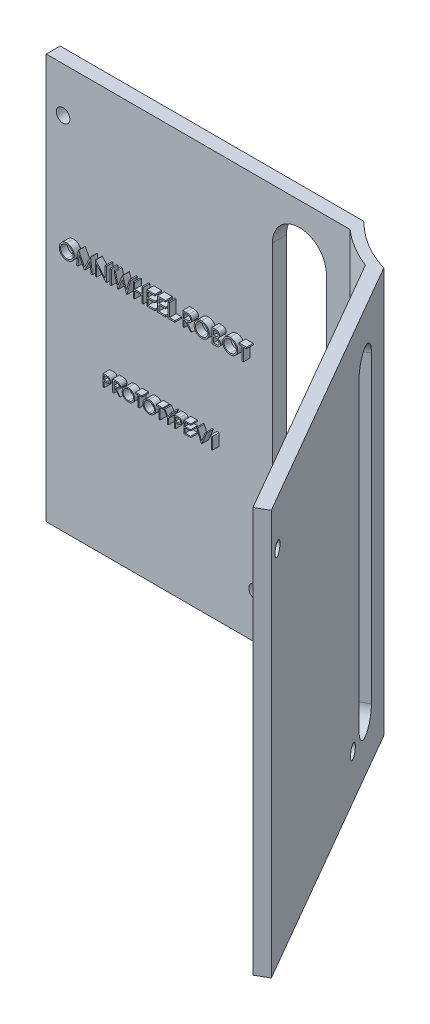
from build123d import *

# Parameters (mm, degrees)
BOSS_EXTRU_1_DEPTH      = 120
ENL_V_MAT_EXTRU_1_DEPTH = 188.009777727
ENL_V_MAT_EXTRU_2_DEPTH = 180.784310366
ESQUISSE6_R             = 2
ENL_V_MAT_EXTRU_3_DEPTH = 188.009777727
ESQUISSE7_R             = 2
ENL_V_MAT_EXTRU_4_DEPTH = 180.784310366
ESQUISSE8_W             = 0.379914529
ESQUISSE8_H             = 4.233333333
BOSS_EXTRU_2_DEPTH      = 2
ESQUISSE9_R             = 2
ENL_V_MAT_EXTRU_5_DEPTH = 188.009777853
ESQUISSE10_R            = 2
ENL_V_MAT_EXTRU_6_DEPTH = 180.784310483


with BuildPart() as part:
    # Esquisse3 → Boss.-Extru.1 (new body)
    with BuildSketch(Plane(origin=(0, 0, 0), x_dir=(1, 0, 0), z_dir=(0, 1, 0))):
        with BuildLine():
            ThreePointArc((-10.103808925, -33.509894736), (-18.121448463, -29.943498553), (-25, -24.494897428))
            Line((-25, -24.494897428), (-115, -24.494897428))
            Line((-115, -24.494897428), (-115, -28.618176043))
            Line((-115, -28.618176043), (-25, -28.618176043))
            ThreePointArc((-25, -28.618176043), (-19.581111, -32.566548666), (-13.552631037, -35.50107311))
            Line((-13.552631037, -35.50107311), (31.963111135, -114.336651096))
            Line((31.963111135, -114.336651096), (35.411933246, -112.345472721))
            Line((35.411933246, -112.345472721), (-10.103808925, -33.509894736))
        make_face()
    extrude(amount=BOSS_EXTRU_1_DEPTH)

    # Esquisse4 → Enlèv. mat.-Extru.1 (cut, through all)
    with BuildSketch(Plane.XY.offset(28.618176043)):
        with BuildLine():
            Line((-48, 105), (-48, 15))
            ThreePointArc((-48, 15), (-40, 7), (-32, 15))
            Line((-32, 15), (-32, 105))
            ThreePointArc((-32, 105), (-40, 113), (-48, 105))
        make_face()
    extrude(amount=-ENL_V_MAT_EXTRU_1_DEPTH, mode=Mode.SUBTRACT)

    # Esquisse5 → Enlèv. mat.-Extru.2 (cut, through all)
    with BuildSketch(Plane(origin=(-25.536888865, 0, 14.743729661), x_dir=(0.4999999999999999, 0, 0.8660254037844386), z_dir=(-0.8660254037844387, 0, 0.49999999999999994))):
        with BuildLine():
            Line((43.968515657, 105), (43.968515657, 15))
            ThreePointArc((43.968515657, 15), (38.968515657, 10), (33.968515657, 15))
            Line((33.968515657, 15), (33.968515657, 105))
            ThreePointArc((33.968515657, 105), (38.968515657, 110), (43.968515657, 105))
        make_face()
    extrude(amount=-ENL_V_MAT_EXTRU_2_DEPTH, mode=Mode.SUBTRACT)

    # Esquisse6 → Enlèv. mat.-Extru.3 (cut, through all)
    with BuildSketch(Plane.XY.offset(28.618176043)):
        with Locations((-110, 106.75)):
            Circle(ESQUISSE6_R)
    extrude(amount=-ENL_V_MAT_EXTRU_3_DEPTH, mode=Mode.SUBTRACT)

    # Esquisse7 → Enlèv. mat.-Extru.4 (cut, through all)
    with BuildSketch(Plane(origin=(-25.536888865, 0, 14.743729661), x_dir=(0.4999999999999999, 0, 0.8660254037844386), z_dir=(-0.8660254037844387, 0, 0.49999999999999994))):
        with Locations((110, 106.75)):
            Circle(ESQUISSE7_R)
    extrude(amount=-ENL_V_MAT_EXTRU_4_DEPTH, mode=Mode.SUBTRACT)

    # Esquisse8 → Boss.-Extru.2 (add)
    # profile 1 of 25: a face of its own
    with BuildSketch(Plane.XY.offset(28.618176043)):
        with BuildLine():
            add(Edge.make_bspline(
                [(-106.927136752, 76.562203816), (-106.848749805, 76.560218407), (-106.694791374, 76.556318902), (-106.468519831, 76.526468938), (-106.252504811, 76.474827848), (-106.044986643, 76.406050716), (-105.848447519, 76.314303031), (-105.661408096, 76.203407661), (-105.484313401, 76.072202802), (-105.319550397, 75.921702689), (-105.168774848, 75.757953178), (-105.035937823, 75.583203706), (-104.924610477, 75.398510869), (-104.833187668, 75.204429674), (-104.761464588, 75.001399046), (-104.71197203, 74.788336585), (-104.680357315, 74.566622779), (-104.67666128, 74.41539981), (-104.674786325, 74.338686188)],
                knots=[0, 0, 0, 0, 1.065120563, 2.091984664, 3.0946048, 4.079830382, 5.057816894, 6.036188127, 7.030412546, 8.04752943, 9.064399622, 10.05169764, 11.02544977, 11.989514704, 12.962713494, 13.945757189, 14.957906945, 16, 16, 16, 16], degree=3))
            add(Edge.make_bspline(
                [(-104.674786325, 74.338686188), (-104.676661005, 74.262537657), (-104.680356217, 74.112440082), (-104.712007977, 73.89213325), (-104.761648043, 73.680356883), (-104.832521622, 73.477464522), (-104.92350863, 73.283242136), (-105.035577265, 73.098200773), (-105.167586158, 72.92227977), (-105.317817302, 72.757406356), (-105.481588086, 72.606218939), (-105.657247552, 72.474478965), (-105.840845186, 72.361117405), (-106.034743595, 72.270664771), (-106.236371259, 72.19836921), (-106.447532735, 72.149077934), (-106.667238567, 72.117283129), (-106.817063496, 72.113632162), (-106.893215812, 72.111776465)],
                knots=[0, 0, 0, 0, 1.043624062, 2.057103931, 3.04512605, 4.022047818, 4.998200453, 5.980619268, 6.982898556, 8.009068085, 9.034988726, 10.034168286, 11.015286542, 11.987931943, 12.962482838, 13.94673481, 14.956375938, 16, 16, 16, 16], degree=3))
            add(Edge.make_bspline(
                [(-106.893215812, 72.111776465), (-106.969929036, 72.113650486), (-107.121151221, 72.117344679), (-107.343143635, 72.149011711), (-107.556355763, 72.198531193), (-107.760177883, 72.269299749), (-107.954723655, 72.36076059), (-108.140373565, 72.472283982), (-108.316382438, 72.604614524), (-108.481291027, 72.754796952), (-108.632178152, 72.918290163), (-108.763725207, 73.093470643), (-108.875273677, 73.276901528), (-108.966427422, 73.469091867), (-109.038593006, 73.669112564), (-109.087826453, 73.878297866), (-109.119680414, 74.095455173), (-109.123351133, 74.243310869), (-109.125213675, 74.318333624)],
                knots=[0, 0, 0, 0, 1.053102029, 2.075944431, 3.073151272, 4.055350789, 5.033113405, 6.020478099, 7.024410459, 8.052272461, 9.079885166, 10.07527673, 11.055994387, 12.023226415, 12.992069828, 13.970394897, 14.97016774, 16, 16, 16, 16], degree=3))
            add(Edge.make_bspline(
                [(-109.125213675, 74.318333624), (-109.124567021, 74.368689328), (-109.12328187, 74.468765478), (-109.107810013, 74.617375556), (-109.085359194, 74.763595685), (-109.053183547, 74.907010069), (-109.011102198, 75.047267641), (-108.961448793, 75.185335707), (-108.900803456, 75.319815068), (-108.832246863, 75.451342789), (-108.7557302, 75.577868542), (-108.671213817, 75.697465752), (-108.581666276, 75.811138006), (-108.483497219, 75.91593962), (-108.37994209, 76.014919375), (-108.269321004, 76.106556186), (-108.152308956, 76.191676364), (-108.028402459, 76.268384777), (-107.900654641, 76.337762016), (-107.768965586, 76.397297017), (-107.635123828, 76.448394634), (-107.498502492, 76.489809727), (-107.359464377, 76.522505618), (-107.217706028, 76.544769751), (-107.073340379, 76.560281069), (-106.976080974, 76.561560143), (-106.927136752, 76.562203816)],
                knots=[0, 0, 0, 0, 1.037015668, 2.060948919, 3.074880161, 4.083647147, 5.086022904, 6.090072063, 7.104153813, 8.122640571, 9.144368836, 10.147691507, 11.138137339, 12.123020368, 13.103399296, 14.087645067, 15.080126199, 16.082011238, 17.087798457, 18.072939717, 19.057185487, 20.037253025, 21.01195951, 21.997135196, 22.992090687, 24, 24, 24, 24], degree=3))
        make_face()
        with BuildLine():
            add(Edge.make_bspline(
                [(-106.908480235, 76.128015782), (-106.948654125, 76.127526057), (-107.02861784, 76.12655129), (-107.147495327, 76.11371133), (-107.26480938, 76.095411369), (-107.380584228, 76.069308005), (-107.494335454, 76.033743103), (-107.607123357, 75.992811719), (-107.717919432, 75.942953829), (-107.826357907, 75.886623034), (-107.93148376, 75.824273387), (-108.030680075, 75.755364678), (-108.124203654, 75.681512903), (-108.21182551, 75.602545709), (-108.293288356, 75.518060953), (-108.370195567, 75.429339435), (-108.439464489, 75.333845243), (-108.502947044, 75.234167894), (-108.559755765, 75.130437219), (-108.610271956, 75.02374529), (-108.651594138, 74.913221803), (-108.685294346, 74.800065822), (-108.713234117, 74.684456561), (-108.730934197, 74.56551701), (-108.743915241, 74.443844827), (-108.744834292, 74.361619156), (-108.745299145, 74.320029671)],
                knots=[0, 0, 0, 0, 1.008559885, 2.007477868, 2.99961109, 3.989939068, 4.984837346, 5.991145699, 7.001802488, 8.033829008, 9.059044045, 10.069351652, 11.065060232, 12.050310815, 13.029377138, 14.011219647, 14.996725999, 15.989392538, 16.977580475, 17.965360261, 18.951710183, 19.937753436, 20.929683414, 21.935841486, 22.955955122, 24, 24, 24, 24], degree=3))
            add(Edge.make_bspline(
                [(-108.745299145, 74.320029671), (-108.743757169, 74.258873461), (-108.740723626, 74.138560276), (-108.714165422, 73.962250236), (-108.673256939, 73.792810118), (-108.612953267, 73.631167047), (-108.537538714, 73.475931581), (-108.444372856, 73.328480826), (-108.333992819, 73.18877493), (-108.208609316, 73.057789224), (-108.071542804, 72.93823287), (-107.925997502, 72.833290461), (-107.773532662, 72.744499016), (-107.613750693, 72.672163357), (-107.447504622, 72.614844341), (-107.273723203, 72.575560664), (-107.093564076, 72.549706541), (-106.970760331, 72.547223684), (-106.908480235, 72.5459645)],
                knots=[0, 0, 0, 0, 1.032063989, 2.030389145, 3.003944642, 3.970395727, 4.937377036, 5.913328081, 6.909231446, 7.93887556, 8.970685674, 9.976071282, 10.964166581, 11.944589148, 12.933237628, 13.927779006, 14.949070134, 16, 16, 16, 16], degree=3))
            add(Edge.make_bspline(
                [(-106.908480235, 72.5459645), (-106.866619219, 72.546539633), (-106.783596251, 72.547680297), (-106.660109286, 72.559169172), (-106.538847011, 72.577592481), (-106.41997951, 72.604118131), (-106.303641691, 72.637316181), (-106.189347977, 72.676756004), (-106.078315759, 72.725960889), (-105.969144336, 72.780326506), (-105.864646025, 72.842302697), (-105.764889905, 72.908872649), (-105.672390386, 72.982615648), (-105.584834081, 73.060409573), (-105.503036781, 73.143822989), (-105.427551628, 73.232747448), (-105.358632802, 73.327744243), (-105.295174353, 73.427270401), (-105.238564692, 73.531284916), (-105.189241401, 73.638363669), (-105.147396575, 73.748242992), (-105.113616384, 73.861081369), (-105.087145397, 73.976664491), (-105.068905875, 74.095147118), (-105.056147287, 74.216292228), (-105.055185622, 74.298230035), (-105.054700855, 74.339534211)],
                knots=[0, 0, 0, 0, 1.047197238, 2.076906641, 3.100256066, 4.114471768, 5.12198147, 6.126382909, 7.136867548, 8.15857795, 9.17633901, 10.174870724, 11.156907918, 12.133735059, 13.104061851, 14.077631395, 15.04955518, 16.038496417, 17.029181396, 18.010275684, 18.986308667, 19.968651475, 20.955262928, 21.950658345, 22.966943676, 24, 24, 24, 24], degree=3))
            add(Edge.make_bspline(
                [(-105.054700855, 74.339534211), (-105.05518601, 74.380555821), (-105.056148406, 74.461929741), (-105.06889978, 74.582229969), (-105.087164667, 74.699860044), (-105.11348718, 74.814358167), (-105.147414509, 74.925753526), (-105.189248709, 75.033941497), (-105.238579499, 75.139325124), (-105.295195161, 75.24164394), (-105.358835252, 75.339826718), (-105.428375909, 75.433688684), (-105.505017806, 75.521467142), (-105.586571188, 75.605329106), (-105.675073116, 75.683485982), (-105.770122691, 75.755963697), (-105.870565997, 75.824511372), (-105.976916081, 75.886348956), (-106.086673054, 75.943455695), (-106.199296603, 75.992382146), (-106.313510847, 76.033956043), (-106.429025345, 76.06941561), (-106.546812376, 76.095309132), (-106.666076055, 76.113727821), (-106.786651377, 76.126546821), (-106.867741748, 76.127524574), (-106.908480235, 76.128015782)],
                knots=[0, 0, 0, 0, 1.02996197, 2.043119294, 3.035359645, 4.018872909, 4.991431989, 5.957985074, 6.929999688, 7.912076566, 8.892894881, 9.867085534, 10.843653904, 11.817741046, 12.803660682, 13.806313499, 14.818574707, 15.856120519, 16.894564902, 17.924820532, 18.937903209, 19.946497019, 20.957711757, 21.963978472, 22.977135795, 24, 24, 24, 24], degree=3))
        make_face(mode=Mode.SUBTRACT)
    # profile 2 of 25: a face of its own
    with BuildSketch(Plane.XY.offset(28.618176043)):
        Polygon((-104.023504274, 72.220323474), (-103.464656784, 76.453656807), (-103.41038328, 76.453656807), (-101.662606838, 72.980152534), (-99.919070513, 76.453656807), (-99.863948985, 76.453656807), (-99.301709402, 72.220323474), (-99.683319979, 72.220323474), (-100.088675214, 75.266423901), (-101.616813568, 72.220323474), (-101.702463942, 72.220323474), (-103.236538462, 75.273208089), (-103.641045673, 72.220323474), align=None)
    # profile 3 of 25: a face of its own
    with BuildSketch(Plane.XY.offset(28.618176043)):
        Polygon((-98.433333333, 72.220323474), (-98.433333333, 76.453656807), (-98.353619124, 76.453656807), (-95.556837607, 73.121772459), (-95.556837607, 76.453656807), (-95.176923077, 76.453656807), (-95.176923077, 72.220323474), (-95.263421474, 72.220323474), (-98.053418803, 75.544575611), (-98.053418803, 72.220323474), align=None)
    # profile 4 of 25: a face of its own
    with BuildSketch(Plane.XY.offset(28.618176043)):
        with Locations((-93.901495727, 74.336990141)):
            Rectangle(ESQUISSE8_W, ESQUISSE8_H)
    # profile 5 of 25: a face of its own
    with BuildSketch(Plane.XY.offset(28.618176043)):
        Polygon((-92.897435897, 76.453656807), (-92.504801015, 76.453656807), (-91.676282051, 73.349042758), (-90.4441039, 76.453656807), (-90.388982372, 76.453656807), (-89.179700855, 73.370243346), (-88.346941774, 76.453656807), (-87.958547009, 76.453656807), (-89.099986645, 72.220323474), (-89.15426015, 72.220323474), (-90.427991453, 75.458077213), (-91.716987179, 72.220323474), (-91.771260684, 72.220323474), align=None)
    # profile 6 of 25: a face of its own
    with BuildSketch(Plane.XY.offset(28.618176043)):
        Polygon((-87.198717949, 76.453656807), (-86.818803419, 76.453656807), (-86.818803419, 74.716904671), (-84.647863248, 74.716904671), (-84.647863248, 76.453656807), (-84.267948718, 76.453656807), (-84.267948718, 72.220323474), (-84.647863248, 72.220323474), (-84.647863248, 74.282716636), (-86.818803419, 74.282716636), (-86.818803419, 72.220323474), (-87.198717949, 72.220323474), align=None)
    # profile 7 of 25: a face of its own
    with BuildSketch(Plane.XY.offset(28.618176043)):
        Polygon((-83.182478632, 76.453656807), (-80.794444444, 76.453656807), (-80.794444444, 76.019468773), (-82.802564103, 76.019468773), (-82.802564103, 74.716904671), (-80.794444444, 74.716904671), (-80.794444444, 74.282716636), (-82.802564103, 74.282716636), (-82.802564103, 72.654511508), (-80.794444444, 72.654511508), (-80.794444444, 72.220323474), (-83.182478632, 72.220323474), align=None)
    # profile 8 of 25: a face of its own
    with BuildSketch(Plane.XY.offset(28.618176043)):
        Polygon((-80.034615385, 76.453656807), (-77.646581197, 76.453656807), (-77.646581197, 76.019468773), (-79.654700855, 76.019468773), (-79.654700855, 74.716904671), (-77.646581197, 74.716904671), (-77.646581197, 74.282716636), (-79.654700855, 74.282716636), (-79.654700855, 72.654511508), (-77.646581197, 72.654511508), (-77.646581197, 72.220323474), (-80.034615385, 72.220323474), align=None)
    # profile 9 of 25: a face of its own
    with BuildSketch(Plane.XY.offset(28.618176043)):
        Polygon((-76.886752137, 76.453656807), (-76.506837607, 76.453656807), (-76.506837607, 72.654511508), (-74.878632479, 72.654511508), (-74.878632479, 72.220323474), (-76.886752137, 72.220323474), align=None)
    # profile 10 of 25: a face of its own
    with BuildSketch(Plane.XY.offset(28.618176043)):
        with BuildLine():
            Line((-72.544871795, 76.453656807), (-71.697696314, 76.453656807))
            add(Edge.make_bspline(
                [(-71.697696314, 76.453656807), (-71.641161806, 76.453468622), (-71.532609289, 76.453107286), (-71.377096857, 76.451092506), (-71.235791702, 76.44531781), (-71.108767705, 76.44034838), (-70.996027199, 76.431286699), (-70.897224476, 76.422625725), (-70.812814594, 76.41128806), (-70.761717231, 76.400758643), (-70.738581731, 76.395991209)],
                knots=[0, 0, 0, 0, 1.410062039, 2.707475311, 3.878576406, 4.937260626, 5.877586885, 6.699081471, 7.410979367, 8, 8, 8, 8], degree=3))
            add(Edge.make_bspline(
                [(-70.738581731, 76.395991209), (-70.707609909, 76.388338836), (-70.646326979, 76.373197335), (-70.558092137, 76.341193818), (-70.474012907, 76.304158653), (-70.394438548, 76.260659677), (-70.319767639, 76.210373991), (-70.249230254, 76.15416969), (-70.182506312, 76.092354308), (-70.122294245, 76.023369309), (-70.065520345, 75.950995626), (-70.017636958, 75.872734892), (-69.976360169, 75.790896663), (-69.943496781, 75.704648644), (-69.917034851, 75.614827262), (-69.898376448, 75.520618908), (-69.887186916, 75.422452776), (-69.886047719, 75.355496068), (-69.885470085, 75.321545429)],
                knots=[0, 0, 0, 0, 1.027469482, 2.033020251, 3.019912614, 3.986113645, 4.951240523, 5.91722682, 6.890402269, 7.87763091, 8.8651537, 9.85103654, 10.82876324, 11.815024772, 12.821070561, 13.842952187, 14.906261191, 16, 16, 16, 16], degree=3))
            add(Edge.make_bspline(
                [(-69.885470085, 75.321545429), (-69.887246874, 75.26513916), (-69.890713848, 75.155075919), (-69.923038497, 74.995345138), (-69.97598724, 74.846344729), (-70.048949694, 74.7082623), (-70.141864679, 74.583789425), (-70.253533712, 74.474460017), (-70.38401909, 74.382971741), (-70.505490739, 74.319528825), (-70.612792675, 74.278897402), (-70.701128206, 74.250308664), (-70.797487312, 74.228220382), (-70.900946755, 74.208432413), (-71.011937081, 74.193492744), (-71.130192272, 74.182550673), (-71.255796665, 74.175711967), (-71.342082967, 74.174693542), (-71.386471688, 74.174169628)],
                knots=[0, 0, 0, 0, 1.260483769, 2.459530307, 3.627416485, 4.787058657, 5.939039949, 7.08810263, 8.267026773, 9.491475466, 10.141966685, 10.831826277, 11.566392101, 12.351337768, 13.187381173, 14.07005841, 15.007169909, 16, 16, 16, 16], degree=3))
            Line((-71.386471688, 74.174169628), (-69.831196581, 72.220323474))
            Line((-69.831196581, 72.220323474), (-70.301001603, 72.220323474))
            Line((-70.301001603, 72.220323474), (-71.856276709, 74.174169628))
            Line((-71.856276709, 74.174169628), (-72.164957265, 74.174169628))
            Line((-72.164957265, 74.174169628), (-72.164957265, 72.220323474))
            Line((-72.164957265, 72.220323474), (-72.544871795, 72.220323474))
            Line((-72.544871795, 72.220323474), (-72.544871795, 76.453656807))
        make_face()
        with BuildLine():
            Line((-72.164957265, 76.019468773), (-72.164957265, 74.608357662))
            Line((-72.164957265, 74.608357662), (-71.389863782, 74.602421497))
            add(Edge.make_bspline(
                [(-71.389863782, 74.602421497), (-71.353674783, 74.602405487), (-71.283530194, 74.602374455), (-71.182050343, 74.607205023), (-71.087562208, 74.612700274), (-71.000427203, 74.621105673), (-70.920606402, 74.631938255), (-70.848139702, 74.645488531), (-70.782908811, 74.661275312), (-70.706831531, 74.685709659), (-70.621878774, 74.724421701), (-70.529554056, 74.78074378), (-70.450932181, 74.851584524), (-70.384507719, 74.932590514), (-70.331132121, 75.02165531), (-70.29350135, 75.117711299), (-70.269622396, 75.218333518), (-70.266805965, 75.287491801), (-70.265384615, 75.322393453)],
                knots=[0, 0, 0, 0, 1.146690395, 2.22261258, 3.21895312, 4.145990853, 4.996080663, 5.770904154, 6.481378293, 7.121626537, 8.300444488, 9.431385265, 10.535395872, 11.636531494, 12.74115979, 13.810798291, 14.895190096, 16, 16, 16, 16], degree=3))
            add(Edge.make_bspline(
                [(-70.265384615, 75.322393453), (-70.266838609, 75.356437404), (-70.269719895, 75.423900092), (-70.293243644, 75.52266486), (-70.333024134, 75.615879171), (-70.386632936, 75.703163834), (-70.451946199, 75.782394581), (-70.528530601, 75.850184947), (-70.614292123, 75.906124776), (-70.694448715, 75.941871503), (-70.766093906, 75.963787897), (-70.828299304, 75.979210733), (-70.89858652, 75.991601662), (-70.977296837, 76.001529507), (-71.064094238, 76.01006263), (-71.159417597, 76.01581002), (-71.262634464, 76.019213455), (-71.334174086, 76.019381687), (-71.371207265, 76.019468773)],
                knots=[0, 0, 0, 0, 1.101028733, 2.181837193, 3.264309656, 4.369019818, 5.486613113, 6.575447106, 7.666700264, 8.788928104, 9.402425223, 10.0903467, 10.862060571, 11.710948788, 12.657782767, 13.684531032, 14.801375019, 16, 16, 16, 16], degree=3))
            Line((-71.371207265, 76.019468773), (-72.164957265, 76.019468773))
        make_face(mode=Mode.SUBTRACT)
    # profile 11 of 25: a face of its own
    with BuildSketch(Plane.XY.offset(28.618176043)):
        with BuildLine():
            add(Edge.make_bspline(
                [(-66.981837607, 76.562203816), (-66.90345066, 76.560218407), (-66.749492228, 76.556318902), (-66.523220685, 76.526468938), (-66.307205665, 76.474827848), (-66.099687497, 76.406050716), (-65.903148373, 76.314303031), (-65.716108951, 76.203407661), (-65.539014256, 76.072202802), (-65.374251252, 75.921702689), (-65.223475702, 75.757953178), (-65.090638678, 75.583203706), (-64.979311332, 75.398510869), (-64.887888523, 75.204429674), (-64.816165443, 75.001399046), (-64.766672885, 74.788336585), (-64.73505817, 74.566622779), (-64.731362135, 74.41539981), (-64.729487179, 74.338686188)],
                knots=[0, 0, 0, 0, 1.065120563, 2.091984664, 3.0946048, 4.079830382, 5.057816894, 6.036188127, 7.030412546, 8.04752943, 9.064399622, 10.05169764, 11.02544977, 11.989514704, 12.962713494, 13.945757189, 14.957906945, 16, 16, 16, 16], degree=3))
            add(Edge.make_bspline(
                [(-64.729487179, 74.338686188), (-64.73136186, 74.262537657), (-64.735057072, 74.112440082), (-64.766708831, 73.89213325), (-64.816348898, 73.680356883), (-64.887222477, 73.477464522), (-64.978209484, 73.283242136), (-65.09027812, 73.098200773), (-65.222287013, 72.92227977), (-65.372518157, 72.757406356), (-65.536288941, 72.606218939), (-65.711948406, 72.474478965), (-65.895546041, 72.361117405), (-66.08944445, 72.270664771), (-66.291072113, 72.19836921), (-66.50223359, 72.149077934), (-66.721939422, 72.117283129), (-66.87176435, 72.113632162), (-66.947916667, 72.111776465)],
                knots=[0, 0, 0, 0, 1.043624062, 2.057103931, 3.04512605, 4.022047818, 4.998200453, 5.980619268, 6.982898556, 8.009068085, 9.034988726, 10.034168286, 11.015286542, 11.987931943, 12.962482838, 13.94673481, 14.956375938, 16, 16, 16, 16], degree=3))
            add(Edge.make_bspline(
                [(-66.947916667, 72.111776465), (-67.024629891, 72.113650486), (-67.175852076, 72.117344679), (-67.39784449, 72.149011711), (-67.611056618, 72.198531193), (-67.814878738, 72.269299749), (-68.00942451, 72.36076059), (-68.19507442, 72.472283982), (-68.371083293, 72.604614524), (-68.535991882, 72.754796952), (-68.686879007, 72.918290163), (-68.818426061, 73.093470643), (-68.929974532, 73.276901528), (-69.021128277, 73.469091867), (-69.093293861, 73.669112564), (-69.142527308, 73.878297866), (-69.174381269, 74.095455173), (-69.178051988, 74.243310869), (-69.17991453, 74.318333624)],
                knots=[0, 0, 0, 0, 1.053102029, 2.075944431, 3.073151272, 4.055350789, 5.033113405, 6.020478099, 7.024410459, 8.052272461, 9.079885166, 10.07527673, 11.055994387, 12.023226415, 12.992069828, 13.970394897, 14.97016774, 16, 16, 16, 16], degree=3))
            add(Edge.make_bspline(
                [(-69.17991453, 74.318333624), (-69.179267876, 74.368689328), (-69.177982725, 74.468765478), (-69.162510868, 74.617375556), (-69.140060048, 74.763595685), (-69.107884402, 74.907010069), (-69.065803052, 75.047267641), (-69.016149648, 75.185335707), (-68.955504311, 75.319815068), (-68.886947718, 75.451342789), (-68.810431055, 75.577868542), (-68.725914672, 75.697465752), (-68.636367131, 75.811138006), (-68.538198074, 75.91593962), (-68.434642945, 76.014919375), (-68.324021859, 76.106556186), (-68.207009811, 76.191676364), (-68.083103314, 76.268384777), (-67.955355495, 76.337762016), (-67.82366644, 76.397297017), (-67.689824683, 76.448394634), (-67.553203346, 76.489809727), (-67.414165232, 76.522505618), (-67.272406883, 76.544769751), (-67.128041234, 76.560281069), (-67.030781829, 76.561560143), (-66.981837607, 76.562203816)],
                knots=[0, 0, 0, 0, 1.037015668, 2.060948919, 3.074880161, 4.083647147, 5.086022904, 6.090072063, 7.104153813, 8.122640571, 9.144368836, 10.147691507, 11.138137339, 12.123020368, 13.103399296, 14.087645067, 15.080126199, 16.082011238, 17.087798457, 18.072939717, 19.057185487, 20.037253025, 21.01195951, 21.997135196, 22.992090687, 24, 24, 24, 24], degree=3))
        make_face()
        with BuildLine():
            add(Edge.make_bspline(
                [(-66.96318109, 76.128015782), (-67.00335498, 76.127526057), (-67.083318695, 76.12655129), (-67.202196182, 76.11371133), (-67.319510235, 76.095411369), (-67.435285082, 76.069308005), (-67.549036309, 76.033743103), (-67.661824212, 75.992811719), (-67.772620287, 75.942953829), (-67.881058762, 75.886623034), (-67.986184615, 75.824273387), (-68.08538093, 75.755364678), (-68.178904509, 75.681512903), (-68.266526365, 75.602545709), (-68.347989211, 75.518060953), (-68.424896422, 75.429339435), (-68.494165344, 75.333845243), (-68.557647899, 75.234167894), (-68.61445662, 75.130437219), (-68.664972811, 75.02374529), (-68.706294993, 74.913221803), (-68.739995201, 74.800065822), (-68.767934972, 74.684456561), (-68.785635051, 74.56551701), (-68.798616096, 74.443844827), (-68.799535147, 74.361619156), (-68.8, 74.320029671)],
                knots=[0, 0, 0, 0, 1.008559885, 2.007477868, 2.99961109, 3.989939068, 4.984837346, 5.991145699, 7.001802488, 8.033829008, 9.059044045, 10.069351652, 11.065060232, 12.050310815, 13.029377138, 14.011219647, 14.996725999, 15.989392538, 16.977580475, 17.965360261, 18.951710183, 19.937753436, 20.929683414, 21.935841486, 22.955955122, 24, 24, 24, 24], degree=3))
            add(Edge.make_bspline(
                [(-68.8, 74.320029671), (-68.798458024, 74.258873461), (-68.795424481, 74.138560276), (-68.768866277, 73.962250236), (-68.727957793, 73.792810118), (-68.667654121, 73.631167047), (-68.592239569, 73.475931581), (-68.499073711, 73.328480826), (-68.388693674, 73.18877493), (-68.26331017, 73.057789224), (-68.126243659, 72.93823287), (-67.980698357, 72.833290461), (-67.828233517, 72.744499016), (-67.668451548, 72.672163357), (-67.502205477, 72.614844341), (-67.328424058, 72.575560664), (-67.148264931, 72.549706541), (-67.025461186, 72.547223684), (-66.96318109, 72.5459645)],
                knots=[0, 0, 0, 0, 1.032063989, 2.030389145, 3.003944642, 3.970395727, 4.937377036, 5.913328081, 6.909231446, 7.93887556, 8.970685674, 9.976071282, 10.964166581, 11.944589148, 12.933237628, 13.927779006, 14.949070134, 16, 16, 16, 16], degree=3))
            add(Edge.make_bspline(
                [(-66.96318109, 72.5459645), (-66.921320074, 72.546539633), (-66.838297106, 72.547680297), (-66.714810141, 72.559169172), (-66.593547865, 72.577592481), (-66.474680365, 72.604118131), (-66.358342546, 72.637316181), (-66.244048831, 72.676756004), (-66.133016613, 72.725960889), (-66.023845191, 72.780326506), (-65.919346879, 72.842302697), (-65.819590759, 72.908872649), (-65.727091241, 72.982615648), (-65.639534935, 73.060409573), (-65.557737635, 73.143822989), (-65.482252483, 73.232747448), (-65.413333656, 73.327744243), (-65.349875208, 73.427270401), (-65.293265547, 73.531284916), (-65.243942256, 73.638363669), (-65.20209743, 73.748242992), (-65.168317238, 73.861081369), (-65.141846251, 73.976664491), (-65.123606729, 74.095147118), (-65.110848142, 74.216292228), (-65.109886477, 74.298230035), (-65.109401709, 74.339534211)],
                knots=[0, 0, 0, 0, 1.047197238, 2.076906641, 3.100256066, 4.114471768, 5.12198147, 6.126382909, 7.136867548, 8.15857795, 9.17633901, 10.174870724, 11.156907918, 12.133735059, 13.104061851, 14.077631395, 15.04955518, 16.038496417, 17.029181396, 18.010275684, 18.986308667, 19.968651475, 20.955262928, 21.950658345, 22.966943676, 24, 24, 24, 24], degree=3))
            add(Edge.make_bspline(
                [(-65.109401709, 74.339534211), (-65.109886865, 74.380555821), (-65.110849261, 74.461929741), (-65.123600635, 74.582229969), (-65.141865521, 74.699860044), (-65.168188035, 74.814358167), (-65.202115364, 74.925753526), (-65.243949563, 75.033941497), (-65.293280354, 75.139325124), (-65.349896016, 75.24164394), (-65.413536107, 75.339826718), (-65.483076763, 75.433688684), (-65.559718661, 75.521467142), (-65.641272043, 75.605329106), (-65.729773971, 75.683485982), (-65.824823546, 75.755963697), (-65.925266851, 75.824511372), (-66.031616936, 75.886348956), (-66.141373909, 75.943455695), (-66.253997458, 75.992382146), (-66.368211702, 76.033956043), (-66.4837262, 76.06941561), (-66.601513231, 76.095309132), (-66.72077691, 76.113727821), (-66.841352232, 76.126546821), (-66.922442602, 76.127524574), (-66.96318109, 76.128015782)],
                knots=[0, 0, 0, 0, 1.02996197, 2.043119294, 3.035359645, 4.018872909, 4.991431989, 5.957985074, 6.929999688, 7.912076566, 8.892894881, 9.867085534, 10.843653904, 11.817741046, 12.803660682, 13.806313499, 14.818574707, 15.856120519, 16.894564902, 17.924820532, 18.937903209, 19.946497019, 20.957711757, 21.963978472, 22.977135795, 24, 24, 24, 24], degree=3))
        make_face(mode=Mode.SUBTRACT)
    # profile 12 of 25: a face of its own
    with BuildSketch(Plane.XY.offset(28.618176043)):
        with BuildLine():
            Line((-63.861111111, 76.453656807), (-63.035136218, 76.453656807))
            add(Edge.make_bspline(
                [(-63.035136218, 76.453656807), (-62.994703678, 76.453444233), (-62.916335352, 76.453032211), (-62.802374694, 76.446642138), (-62.695635656, 76.437929128), (-62.596087284, 76.424104159), (-62.503775577, 76.407422676), (-62.41842234, 76.387221432), (-62.340298988, 76.362998766), (-62.247029298, 76.32447993), (-62.140687165, 76.267241431), (-62.025542442, 76.182661167), (-61.927082077, 76.079207616), (-61.842190055, 75.962509547), (-61.774697272, 75.834135804), (-61.725869646, 75.697146119), (-61.694956787, 75.553307441), (-61.691777633, 75.454558073), (-61.69017094, 75.404651733)],
                knots=[0, 0, 0, 0, 1.001505555, 1.941167018, 2.826882275, 3.653841531, 4.429895133, 5.150066043, 5.825578002, 6.45369114, 7.647487171, 8.808567382, 9.977351308, 11.170798116, 12.373658725, 13.556498008, 14.765093433, 16, 16, 16, 16], degree=3))
            add(Edge.make_bspline(
                [(-61.69017094, 75.404651733), (-61.691493214, 75.357900546), (-61.694091606, 75.266030056), (-61.718938563, 75.131659086), (-61.757837657, 75.003750469), (-61.811909721, 74.882771012), (-61.882185468, 74.771454166), (-61.965471244, 74.668901949), (-62.065954615, 74.579456384), (-62.141239296, 74.529451159), (-62.179480502, 74.504050771)],
                knots=[0, 0, 0, 0, 1.044552857, 2.05264487, 3.044412934, 4.028983338, 5.005914585, 5.980388656, 6.974128949, 8, 8, 8, 8], degree=3))
            add(Edge.make_bspline(
                [(-62.179480502, 74.504050771), (-62.131389318, 74.485587391), (-62.039378971, 74.450262372), (-61.912758746, 74.387808049), (-61.803665933, 74.319878639), (-61.711261766, 74.245696306), (-61.632234317, 74.165736126), (-61.563227426, 74.078825654), (-61.504346145, 73.983831157), (-61.453893371, 73.881743071), (-61.414524875, 73.773603819), (-61.385041638, 73.660427737), (-61.368147676, 73.542620656), (-61.365743577, 73.462446912), (-61.364529915, 73.42197278)],
                knots=[0, 0, 0, 0, 1.27268992, 2.434971085, 3.483601985, 4.442670788, 5.356604649, 6.2567628, 7.179492994, 8.113709626, 9.066344395, 10.018646069, 10.999752585, 12, 12, 12, 12], degree=3))
            add(Edge.make_bspline(
                [(-61.364529915, 73.42197278), (-61.365711433, 73.380647134), (-61.368036104, 73.299337769), (-61.385187117, 73.179891083), (-61.414226704, 73.065742338), (-61.454227043, 72.956153212), (-61.50643289, 72.851335716), (-61.569966714, 72.751171101), (-61.645721081, 72.656665768), (-61.730463789, 72.566769577), (-61.826333241, 72.485939777), (-61.929766583, 72.413954112), (-62.042066418, 72.354752685), (-62.161388353, 72.305021878), (-62.289070907, 72.267034124), (-62.424540727, 72.240457772), (-62.567680978, 72.222550727), (-62.665906106, 72.221078489), (-62.71627938, 72.220323474)],
                knots=[0, 0, 0, 0, 0.978564426, 1.925352924, 2.850884081, 3.763762016, 4.682927383, 5.618979971, 6.567305752, 7.547517671, 8.540179244, 9.531824382, 10.526200242, 11.540722885, 12.589160233, 13.674978461, 14.80764778, 16, 16, 16, 16], degree=3))
            Line((-62.71627938, 72.220323474), (-63.861111111, 72.220323474))
            Line((-63.861111111, 72.220323474), (-63.861111111, 76.453656807))
        make_face()
        with BuildLine():
            Line((-63.481196581, 76.019468773), (-63.481196581, 74.662631166))
            Line((-63.481196581, 74.662631166), (-63.225941506, 74.662631166))
            add(Edge.make_bspline(
                [(-63.225941506, 74.662631166), (-63.188629154, 74.663114883), (-63.116534085, 74.664049521), (-63.012128115, 74.666726823), (-62.915214998, 74.674223504), (-62.825962019, 74.68171803), (-62.744509729, 74.693903484), (-62.671038583, 74.708408242), (-62.604395518, 74.723748518), (-62.527542925, 74.749837326), (-62.440368977, 74.788394133), (-62.347437508, 74.848231497), (-62.265511055, 74.919501905), (-62.196329694, 75.001738592), (-62.139710106, 75.092291026), (-62.100383994, 75.189714396), (-62.073717278, 75.291580651), (-62.071308474, 75.361513204), (-62.07008547, 75.397019521)],
                knots=[0, 0, 0, 0, 1.156816544, 2.235205308, 3.236616184, 4.169592532, 5.011045266, 5.787822928, 6.49130361, 7.128639758, 8.301311294, 9.436451833, 10.541879658, 11.654887649, 12.756523258, 13.837046038, 14.901820046, 16, 16, 16, 16], degree=3))
            add(Edge.make_bspline(
                [(-62.07008547, 75.397019521), (-62.070721898, 75.420515454), (-62.07197032, 75.466605293), (-62.08219479, 75.533793559), (-62.099572714, 75.596983622), (-62.121893621, 75.65704145), (-62.153085654, 75.712089117), (-62.189810986, 75.764029935), (-62.234183201, 75.811095068), (-62.284689665, 75.855084843), (-62.342757238, 75.894085367), (-62.408351276, 75.928243242), (-62.482359229, 75.955748753), (-62.563533825, 75.979837814), (-62.653124569, 75.996756988), (-62.7500976, 76.010852038), (-62.855247212, 76.018027831), (-62.927994146, 76.018977746), (-62.965598291, 76.019468773)],
                knots=[0, 0, 0, 0, 0.91205012, 1.789085906, 2.630437955, 3.453916878, 4.269457761, 5.079663411, 5.91843418, 6.774407191, 7.675494373, 8.627863946, 9.638891023, 10.736472738, 11.911756761, 13.175263542, 14.539845004, 16, 16, 16, 16], degree=3))
            Line((-62.965598291, 76.019468773), (-63.481196581, 76.019468773))
        make_face(mode=Mode.SUBTRACT)
        with BuildLine():
            Line((-63.481196581, 74.228443132), (-63.481196581, 72.654511508))
            Line((-63.481196581, 72.654511508), (-62.940157585, 72.654511508))
            add(Edge.make_bspline(
                [(-62.940157585, 72.654511508), (-62.901429932, 72.65497566), (-62.826787486, 72.655870251), (-62.719017427, 72.658790712), (-62.619131197, 72.66543375), (-62.527584594, 72.675891111), (-62.443389094, 72.687234569), (-62.36755473, 72.702488213), (-62.299466772, 72.719964575), (-62.220515943, 72.746978288), (-62.131611699, 72.788944496), (-62.035804283, 72.852219798), (-61.950622095, 72.927601323), (-61.87828621, 73.014845381), (-61.819003833, 73.109709938), (-61.775877711, 73.210276219), (-61.749279247, 73.314882523), (-61.746059289, 73.386204166), (-61.744444444, 73.42197278)],
                knots=[0, 0, 0, 0, 1.160039823, 2.235823828, 3.228722157, 4.157150951, 4.99529583, 5.772374946, 6.472645482, 7.099169577, 8.269452708, 9.405989375, 10.527446681, 11.663510218, 12.788923519, 13.866172445, 14.929861265, 16, 16, 16, 16], degree=3))
            add(Edge.make_bspline(
                [(-61.744444444, 73.42197278), (-61.744778399, 73.444340915), (-61.745440922, 73.488716386), (-61.755432332, 73.553928854), (-61.769963394, 73.617097291), (-61.788749033, 73.678393224), (-61.816107817, 73.736708451), (-61.848047162, 73.793196309), (-61.885495714, 73.84793147), (-61.943848182, 73.917131052), (-62.028722868, 73.996859249), (-62.149320587, 74.074918895), (-62.28644708, 74.137871956), (-62.385903191, 74.164601799), (-62.437279647, 74.178409745)],
                knots=[0, 0, 0, 0, 0.723448775, 1.435228256, 2.130040452, 2.821711965, 3.505591119, 4.210454504, 4.921174351, 5.648778258, 7.137944449, 8.670945889, 10.280296675, 12, 12, 12, 12], degree=3))
            add(Edge.make_bspline(
                [(-62.437279647, 74.178409745), (-62.457876744, 74.182588752), (-62.502535499, 74.191649699), (-62.575358001, 74.201214255), (-62.658495671, 74.209735423), (-62.752140484, 74.216038442), (-62.856410921, 74.222553594), (-62.97152967, 74.22508733), (-63.097026612, 74.228110245), (-63.184103101, 74.228329331), (-63.2293336, 74.228443132)],
                knots=[0, 0, 0, 0, 0.634451884, 1.375622551, 2.216452059, 3.157844607, 4.20941857, 5.370758133, 6.634282058, 8, 8, 8, 8], degree=3))
            Line((-63.2293336, 74.228443132), (-63.481196581, 74.228443132))
        make_face(mode=Mode.SUBTRACT)
    # profile 13 of 25: a face of its own
    with BuildSketch(Plane.XY.offset(28.618176043)):
        with BuildLine():
            add(Edge.make_bspline(
                [(-58.51517094, 76.562203816), (-58.436783993, 76.560218407), (-58.282825562, 76.556318902), (-58.056554019, 76.526468938), (-57.840538999, 76.474827848), (-57.633020831, 76.406050716), (-57.436481707, 76.314303031), (-57.249442284, 76.203407661), (-57.072347589, 76.072202802), (-56.907584585, 75.921702689), (-56.756809036, 75.757953178), (-56.623972011, 75.583203706), (-56.512644666, 75.398510869), (-56.421221856, 75.204429674), (-56.349498776, 75.001399046), (-56.300006218, 74.788336585), (-56.268391503, 74.566622779), (-56.264695468, 74.41539981), (-56.262820513, 74.338686188)],
                knots=[0, 0, 0, 0, 1.065120563, 2.091984664, 3.0946048, 4.079830382, 5.057816894, 6.036188127, 7.030412546, 8.04752943, 9.064399622, 10.05169764, 11.02544977, 11.989514704, 12.962713494, 13.945757189, 14.957906945, 16, 16, 16, 16], degree=3))
            add(Edge.make_bspline(
                [(-56.262820513, 74.338686188), (-56.264695193, 74.262537657), (-56.268390405, 74.112440082), (-56.300042165, 73.89213325), (-56.349682231, 73.680356883), (-56.42055581, 73.477464522), (-56.511542818, 73.283242136), (-56.623611453, 73.098200773), (-56.755620346, 72.92227977), (-56.90585149, 72.757406356), (-57.069622274, 72.606218939), (-57.24528174, 72.474478965), (-57.428879374, 72.361117405), (-57.622777783, 72.270664771), (-57.824405447, 72.19836921), (-58.035566923, 72.149077934), (-58.255272755, 72.117283129), (-58.405097684, 72.113632162), (-58.48125, 72.111776465)],
                knots=[0, 0, 0, 0, 1.043624062, 2.057103931, 3.04512605, 4.022047818, 4.998200453, 5.980619268, 6.982898556, 8.009068085, 9.034988726, 10.034168286, 11.015286542, 11.987931943, 12.962482838, 13.94673481, 14.956375938, 16, 16, 16, 16], degree=3))
            add(Edge.make_bspline(
                [(-58.48125, 72.111776465), (-58.557963224, 72.113650486), (-58.709185409, 72.117344679), (-58.931177823, 72.149011711), (-59.144389951, 72.198531193), (-59.348212071, 72.269299749), (-59.542757843, 72.36076059), (-59.728407753, 72.472283982), (-59.904416626, 72.604614524), (-60.069325215, 72.754796952), (-60.22021234, 72.918290163), (-60.351759395, 73.093470643), (-60.463307865, 73.276901528), (-60.55446161, 73.469091867), (-60.626627194, 73.669112564), (-60.675860641, 73.878297866), (-60.707714602, 74.095455173), (-60.711385321, 74.243310869), (-60.713247863, 74.318333624)],
                knots=[0, 0, 0, 0, 1.053102029, 2.075944431, 3.073151272, 4.055350789, 5.033113405, 6.020478099, 7.024410459, 8.052272461, 9.079885166, 10.07527673, 11.055994387, 12.023226415, 12.992069828, 13.970394897, 14.97016774, 16, 16, 16, 16], degree=3))
            add(Edge.make_bspline(
                [(-60.713247863, 74.318333624), (-60.712601209, 74.368689328), (-60.711316058, 74.468765478), (-60.695844201, 74.617375556), (-60.673393382, 74.763595685), (-60.641217735, 74.907010069), (-60.599136386, 75.047267641), (-60.549482981, 75.185335707), (-60.488837644, 75.319815068), (-60.420281051, 75.451342789), (-60.343764388, 75.577868542), (-60.259248005, 75.697465752), (-60.169700464, 75.811138006), (-60.071531407, 75.91593962), (-59.967976278, 76.014919375), (-59.857355192, 76.106556186), (-59.740343144, 76.191676364), (-59.616436647, 76.268384777), (-59.488688829, 76.337762016), (-59.356999774, 76.397297017), (-59.223158016, 76.448394634), (-59.08653668, 76.489809727), (-58.947498565, 76.522505618), (-58.805740216, 76.544769751), (-58.661374567, 76.560281069), (-58.564115162, 76.561560143), (-58.51517094, 76.562203816)],
                knots=[0, 0, 0, 0, 1.037015668, 2.060948919, 3.074880161, 4.083647147, 5.086022904, 6.090072063, 7.104153813, 8.122640571, 9.144368836, 10.147691507, 11.138137339, 12.123020368, 13.103399296, 14.087645067, 15.080126199, 16.082011238, 17.087798457, 18.072939717, 19.057185487, 20.037253025, 21.01195951, 21.997135196, 22.992090687, 24, 24, 24, 24], degree=3))
        make_face()
        with BuildLine():
            add(Edge.make_bspline(
                [(-58.496514423, 76.128015782), (-58.536688313, 76.127526057), (-58.616652028, 76.12655129), (-58.735529515, 76.11371133), (-58.852843568, 76.095411369), (-58.968618416, 76.069308005), (-59.082369642, 76.033743103), (-59.195157545, 75.992811719), (-59.30595362, 75.942953829), (-59.414392096, 75.886623034), (-59.519517948, 75.824273387), (-59.618714263, 75.755364678), (-59.712237842, 75.681512903), (-59.799859698, 75.602545709), (-59.881322545, 75.518060953), (-59.958229755, 75.429339435), (-60.027498677, 75.333845243), (-60.090981232, 75.234167894), (-60.147789953, 75.130437219), (-60.198306144, 75.02374529), (-60.239628326, 74.913221803), (-60.273328534, 74.800065822), (-60.301268305, 74.684456561), (-60.318968385, 74.56551701), (-60.331949429, 74.443844827), (-60.33286848, 74.361619156), (-60.333333333, 74.320029671)],
                knots=[0, 0, 0, 0, 1.008559885, 2.007477868, 2.99961109, 3.989939068, 4.984837346, 5.991145699, 7.001802488, 8.033829008, 9.059044045, 10.069351652, 11.065060232, 12.050310815, 13.029377138, 14.011219647, 14.996725999, 15.989392538, 16.977580475, 17.965360261, 18.951710183, 19.937753436, 20.929683414, 21.935841486, 22.955955122, 24, 24, 24, 24], degree=3))
            add(Edge.make_bspline(
                [(-60.333333333, 74.320029671), (-60.331791357, 74.258873461), (-60.328757814, 74.138560276), (-60.30219961, 73.962250236), (-60.261291127, 73.792810118), (-60.200987455, 73.631167047), (-60.125572902, 73.475931581), (-60.032407044, 73.328480826), (-59.922027007, 73.18877493), (-59.796643504, 73.057789224), (-59.659576992, 72.93823287), (-59.51403169, 72.833290461), (-59.36156685, 72.744499016), (-59.201784881, 72.672163357), (-59.03553881, 72.614844341), (-58.861757392, 72.575560664), (-58.681598264, 72.549706541), (-58.558794519, 72.547223684), (-58.496514423, 72.5459645)],
                knots=[0, 0, 0, 0, 1.032063989, 2.030389145, 3.003944642, 3.970395727, 4.937377036, 5.913328081, 6.909231446, 7.93887556, 8.970685674, 9.976071282, 10.964166581, 11.944589148, 12.933237628, 13.927779006, 14.949070134, 16, 16, 16, 16], degree=3))
            add(Edge.make_bspline(
                [(-58.496514423, 72.5459645), (-58.454653407, 72.546539633), (-58.371630439, 72.547680297), (-58.248143474, 72.559169172), (-58.126881199, 72.577592481), (-58.008013698, 72.604118131), (-57.891675879, 72.637316181), (-57.777382165, 72.676756004), (-57.666349947, 72.725960889), (-57.557178524, 72.780326506), (-57.452680213, 72.842302697), (-57.352924093, 72.908872649), (-57.260424574, 72.982615648), (-57.172868269, 73.060409573), (-57.091070969, 73.143822989), (-57.015585816, 73.232747448), (-56.94666699, 73.327744243), (-56.883208541, 73.427270401), (-56.82659888, 73.531284916), (-56.777275589, 73.638363669), (-56.735430763, 73.748242992), (-56.701650572, 73.861081369), (-56.675179585, 73.976664491), (-56.656940063, 74.095147118), (-56.644181475, 74.216292228), (-56.64321981, 74.298230035), (-56.642735043, 74.339534211)],
                knots=[0, 0, 0, 0, 1.047197238, 2.076906641, 3.100256066, 4.114471768, 5.12198147, 6.126382909, 7.136867548, 8.15857795, 9.17633901, 10.174870724, 11.156907918, 12.133735059, 13.104061851, 14.077631395, 15.04955518, 16.038496417, 17.029181396, 18.010275684, 18.986308667, 19.968651475, 20.955262928, 21.950658345, 22.966943676, 24, 24, 24, 24], degree=3))
            add(Edge.make_bspline(
                [(-56.642735043, 74.339534211), (-56.643220198, 74.380555821), (-56.644182594, 74.461929741), (-56.656933968, 74.582229969), (-56.675198855, 74.699860044), (-56.701521368, 74.814358167), (-56.735448697, 74.925753526), (-56.777282897, 75.033941497), (-56.826613687, 75.139325124), (-56.883229349, 75.24164394), (-56.946869441, 75.339826718), (-57.016410097, 75.433688684), (-57.093051994, 75.521467142), (-57.174605376, 75.605329106), (-57.263107304, 75.683485982), (-57.358156879, 75.755963697), (-57.458600185, 75.824511372), (-57.564950269, 75.886348956), (-57.674707242, 75.943455695), (-57.787330791, 75.992382146), (-57.901545035, 76.033956043), (-58.017059533, 76.06941561), (-58.134846564, 76.095309132), (-58.254110243, 76.113727821), (-58.374685565, 76.126546821), (-58.455775936, 76.127524574), (-58.496514423, 76.128015782)],
                knots=[0, 0, 0, 0, 1.02996197, 2.043119294, 3.035359645, 4.018872909, 4.991431989, 5.957985074, 6.929999688, 7.912076566, 8.892894881, 9.867085534, 10.843653904, 11.817741046, 12.803660682, 13.806313499, 14.818574707, 15.856120519, 16.894564902, 17.924820532, 18.937903209, 19.946497019, 20.957711757, 21.963978472, 22.977135795, 24, 24, 24, 24], degree=3))
        make_face(mode=Mode.SUBTRACT)
    # profile 14 of 25: a face of its own
    with BuildSketch(Plane.XY.offset(28.618176043)):
        Polygon((-55.882905983, 76.019468773), (-55.882905983, 76.453656807), (-53.657692308, 76.453656807), (-53.657692308, 76.019468773), (-54.58034188, 76.019468773), (-54.58034188, 72.220323474), (-54.96025641, 72.220323474), (-54.96025641, 76.019468773), align=None)
    # profile 15 of 25: a face of its own
    with BuildSketch(Plane.XY.offset(28.618176043)):
        with BuildLine():
            Line((-96.167273651, 48.474957602), (-95.480875414, 48.474957602))
            add(Edge.make_bspline(
                [(-95.480875414, 48.474957602), (-95.433664508, 48.474905705), (-95.343206315, 48.47480627), (-95.213491259, 48.471791524), (-95.095681528, 48.467764832), (-94.990031147, 48.462182939), (-94.896215049, 48.455586348), (-94.814657749, 48.446334309), (-94.744718193, 48.436674014), (-94.702811744, 48.426852607), (-94.683699933, 48.422373467)],
                knots=[0, 0, 0, 0, 1.415646017, 2.712440637, 3.8905458, 4.950247383, 5.884950622, 6.709939814, 7.411656543, 8, 8, 8, 8], degree=3))
            add(Edge.make_bspline(
                [(-94.683699933, 48.422373467), (-94.6595064, 48.415751517), (-94.611689422, 48.402663655), (-94.542788379, 48.376449932), (-94.477234534, 48.345367767), (-94.414802975, 48.309943827), (-94.356260892, 48.268658263), (-94.300734851, 48.223184645), (-94.248714871, 48.172473076), (-94.200493479, 48.117092337), (-94.156208682, 48.057972127), (-94.118078999, 47.994229897), (-94.086151772, 47.926938593), (-94.0587685, 47.856145022), (-94.039060046, 47.781254699), (-94.024213146, 47.702787986), (-94.014789519, 47.620753296), (-94.013886957, 47.564693429), (-94.013427497, 47.536155518)],
                knots=[0, 0, 0, 0, 0.999701418, 1.975846123, 2.934577507, 3.890451536, 4.834027766, 5.787354733, 6.749476667, 7.726910423, 8.712836071, 9.690891519, 10.682875813, 11.679750201, 12.712814741, 13.765529915, 14.8625177, 16, 16, 16, 16], degree=3))
            add(Edge.make_bspline(
                [(-94.013427497, 47.536155518), (-94.013848922, 47.507377741), (-94.014673468, 47.451072077), (-94.024569754, 47.368699289), (-94.037899945, 47.289980899), (-94.058396997, 47.215091449), (-94.085242671, 47.144475678), (-94.116734723, 47.077054446), (-94.154718254, 47.013974774), (-94.198363083, 46.955007657), (-94.246914678, 46.900097744), (-94.300167616, 46.84964295), (-94.357906909, 46.803938612), (-94.419949057, 46.762882268), (-94.486898905, 46.727425988), (-94.557741059, 46.695668683), (-94.633091275, 46.668997623), (-94.685233789, 46.654967561), (-94.711744805, 46.647834204)],
                knots=[0, 0, 0, 0, 1.121902311, 2.195077645, 3.232258892, 4.234102512, 5.217864754, 6.176164875, 7.132989551, 8.084763148, 9.034132444, 9.988522005, 10.94243251, 11.903244335, 12.886203696, 13.894208494, 14.929344452, 16, 16, 16, 16], degree=3))
            add(Edge.make_bspline(
                [(-94.711744805, 46.647834204), (-94.733672139, 46.643171223), (-94.781727167, 46.632952029), (-94.860869889, 46.621543572), (-94.953015275, 46.611805971), (-95.058037555, 46.604504834), (-95.175842459, 46.598254465), (-95.306493717, 46.593286371), (-95.450247794, 46.590556518), (-95.550519038, 46.590415725), (-95.602870606, 46.590342217)],
                knots=[0, 0, 0, 0, 0.601384939, 1.31797006, 2.144135048, 3.087295005, 4.142315834, 5.309527816, 6.595305764, 8, 8, 8, 8], degree=3))
            Line((-95.602870606, 46.590342217), (-95.853171087, 46.590342217))
            Line((-95.853171087, 46.590342217), (-95.853171087, 44.974957602))
            Line((-95.853171087, 44.974957602), (-96.167273651, 44.974957602))
            Line((-96.167273651, 44.974957602), (-96.167273651, 48.474957602))
        make_face()
        with BuildLine():
            Line((-95.853171087, 48.115983243), (-95.853171087, 46.949316576))
            Line((-95.853171087, 46.949316576), (-95.240390639, 46.941604236))
            add(Edge.make_bspline(
                [(-95.240390639, 46.941604236), (-95.210470713, 46.941588773), (-95.152710913, 46.94155892), (-95.06927469, 46.945544144), (-94.991865402, 46.950144677), (-94.920720827, 46.9568806), (-94.855808892, 46.966401858), (-94.797021364, 46.976013595), (-94.744814081, 46.989918958), (-94.683714879, 47.008642027), (-94.615631531, 47.040574643), (-94.541563983, 47.086924533), (-94.478793397, 47.146005241), (-94.4244751, 47.212433072), (-94.381369222, 47.286332202), (-94.349813229, 47.365401139), (-94.331272072, 47.448828988), (-94.328785878, 47.505917127), (-94.327530062, 47.534753275)],
                knots=[0, 0, 0, 0, 1.160613943, 2.240541288, 3.23993089, 4.169200891, 5.011653406, 5.7853311, 6.478053781, 7.106038997, 8.262395093, 9.384106736, 10.481365981, 11.59014053, 12.70357646, 13.786202915, 14.881775077, 16, 16, 16, 16], degree=3))
            add(Edge.make_bspline(
                [(-94.327530062, 47.534753275), (-94.328792708, 47.562891788), (-94.331302693, 47.61882767), (-94.349958556, 47.700806431), (-94.38130787, 47.779042135), (-94.424764465, 47.852015221), (-94.477505595, 47.918204025), (-94.538804938, 47.975701152), (-94.608518199, 48.021922854), (-94.67336643, 48.051756136), (-94.730967616, 48.069971411), (-94.780999576, 48.082716252), (-94.83749025, 48.092891858), (-94.90045803, 48.101131361), (-94.969414864, 48.108184822), (-95.044953179, 48.112970799), (-95.126786822, 48.115772256), (-95.183597393, 48.115911211), (-95.213046889, 48.115983243)],
                knots=[0, 0, 0, 0, 1.120700087, 2.227813068, 3.331159281, 4.466773991, 5.599788987, 6.693661531, 7.80175334, 8.91857717, 9.525282508, 10.207424825, 10.974604443, 11.810962634, 12.737642355, 13.736264703, 14.826523623, 16, 16, 16, 16], degree=3))
            Line((-95.213046889, 48.115983243), (-95.853171087, 48.115983243))
        make_face(mode=Mode.SUBTRACT)
    # profile 16 of 25: a face of its own
    with BuildSketch(Plane.XY.offset(28.618176043)):
        with BuildLine():
            Line((-93.29547878, 48.474957602), (-92.595058106, 48.474957602))
            add(Edge.make_bspline(
                [(-92.595058106, 48.474957602), (-92.548316978, 48.474802016), (-92.458568834, 48.474503273), (-92.329995563, 48.47283751), (-92.213168466, 48.468063155), (-92.108148627, 48.463954571), (-92.014937972, 48.45646263), (-91.933250681, 48.449301983), (-91.863462984, 48.439928322), (-91.821217132, 48.431222899), (-91.802089356, 48.427281319)],
                knots=[0, 0, 0, 0, 1.410062039, 2.707475311, 3.878576406, 4.937260626, 5.877586885, 6.699081471, 7.410979367, 8, 8, 8, 8], degree=3))
            add(Edge.make_bspline(
                [(-91.802089356, 48.427281319), (-91.776482732, 48.420954554), (-91.725815743, 48.40843599), (-91.652865677, 48.38197639), (-91.583351353, 48.351356765), (-91.517561529, 48.315393045), (-91.455825737, 48.273818265), (-91.397507427, 48.227350143), (-91.342341963, 48.176242937), (-91.292560333, 48.119208095), (-91.245621281, 48.059371586), (-91.206032655, 47.994667829), (-91.171906175, 47.927006301), (-91.144735658, 47.855698884), (-91.122857685, 47.781437112), (-91.107431445, 47.703548315), (-91.098180258, 47.62238734), (-91.097238402, 47.567029431), (-91.096760831, 47.538960005)],
                knots=[0, 0, 0, 0, 1.027469482, 2.033020251, 3.019912614, 3.986113645, 4.951240523, 5.91722682, 6.890402269, 7.87763091, 8.8651537, 9.85103654, 10.82876324, 11.815024772, 12.821070561, 13.842952187, 14.906261191, 16, 16, 16, 16], degree=3))
            add(Edge.make_bspline(
                [(-91.096760831, 47.538960005), (-91.098229829, 47.492324901), (-91.101096225, 47.401327733), (-91.127821328, 47.269266851), (-91.171597848, 47.146077537), (-91.231921137, 47.031914899), (-91.308740613, 46.929004254), (-91.401065404, 46.838613798), (-91.508947015, 46.762973886), (-91.609376331, 46.710521081), (-91.698090531, 46.676928172), (-91.771123844, 46.653291813), (-91.850790821, 46.635029848), (-91.936328156, 46.618669716), (-92.028091811, 46.606318022), (-92.125861851, 46.597271428), (-92.229708002, 46.591617379), (-92.301047072, 46.590775374), (-92.337746408, 46.590342217)],
                knots=[0, 0, 0, 0, 1.260483769, 2.459530307, 3.627416485, 4.787058657, 5.939039949, 7.08810263, 8.267026773, 9.491475466, 10.141966685, 10.831826277, 11.566392101, 12.351337768, 13.187381173, 14.07005841, 15.007169909, 16, 16, 16, 16], degree=3))
            Line((-92.337746408, 46.590342217), (-91.051889036, 44.974957602))
            Line((-91.051889036, 44.974957602), (-91.44031051, 44.974957602))
            Line((-91.44031051, 44.974957602), (-92.726167882, 46.590342217))
            Line((-92.726167882, 46.590342217), (-92.981376215, 46.590342217))
            Line((-92.981376215, 46.590342217), (-92.981376215, 44.974957602))
            Line((-92.981376215, 44.974957602), (-93.29547878, 44.974957602))
            Line((-93.29547878, 44.974957602), (-93.29547878, 48.474957602))
        make_face()
        with BuildLine():
            Line((-92.981376215, 48.115983243), (-92.981376215, 46.949316576))
            Line((-92.981376215, 46.949316576), (-92.340550895, 46.944408723))
            add(Edge.make_bspline(
                [(-92.340550895, 46.944408723), (-92.310630856, 46.944395487), (-92.252637299, 46.94436983), (-92.168736634, 46.948363607), (-92.090616522, 46.952906925), (-92.01857577, 46.95985627), (-91.952582195, 46.968812342), (-91.892668782, 46.980015326), (-91.83873773, 46.993067389), (-91.775839191, 47.013269015), (-91.70560266, 47.045275033), (-91.6292712, 47.091840532), (-91.564268862, 47.150409651), (-91.509351, 47.217383107), (-91.465221569, 47.291019356), (-91.434109514, 47.370435725), (-91.414367072, 47.453627323), (-91.412038527, 47.510805431), (-91.410863395, 47.539661127)],
                knots=[0, 0, 0, 0, 1.146690395, 2.22261258, 3.21895312, 4.145990853, 4.996080663, 5.770904154, 6.481378293, 7.121626537, 8.300444488, 9.431385265, 10.535395872, 11.636531494, 12.74115979, 13.810798291, 14.895190096, 16, 16, 16, 16], degree=3))
            add(Edge.make_bspline(
                [(-91.410863395, 47.539661127), (-91.412065516, 47.567807701), (-91.414447681, 47.62358394), (-91.43389645, 47.70523985), (-91.466785831, 47.7823068), (-91.511108069, 47.854471285), (-91.565107224, 47.919977021), (-91.628425037, 47.976024174), (-91.699330232, 48.022273639), (-91.76560143, 48.051828019), (-91.824835643, 48.069947872), (-91.876265303, 48.082699036), (-91.934376781, 48.092943505), (-91.999452239, 48.101151566), (-92.07121387, 48.10820651), (-92.150024521, 48.112958289), (-92.235361301, 48.115772153), (-92.294508233, 48.115911242), (-92.325126215, 48.115983243)],
                knots=[0, 0, 0, 0, 1.101028733, 2.181837193, 3.264309656, 4.369019818, 5.486613113, 6.575447106, 7.666700264, 8.788928104, 9.402425223, 10.0903467, 10.862060571, 11.710948788, 12.657782767, 13.684531032, 14.801375019, 16, 16, 16, 16], degree=3))
            Line((-92.325126215, 48.115983243), (-92.981376215, 48.115983243))
        make_face(mode=Mode.SUBTRACT)
    # profile 17 of 25: a face of its own
    with BuildSketch(Plane.XY.offset(28.618176043)):
        with BuildLine():
            add(Edge.make_bspline(
                [(-88.696119805, 48.564701191), (-88.631311699, 48.563059712), (-88.504023232, 48.559835711), (-88.316948335, 48.535156607), (-88.138353239, 48.492461217), (-87.966783101, 48.435598235), (-87.804290124, 48.35974385), (-87.649651231, 48.268058701), (-87.503234358, 48.159582243), (-87.367012976, 48.035153016), (-87.242356026, 47.899769562), (-87.13253014, 47.755291652), (-87.040487846, 47.602592849), (-86.964902059, 47.442132019), (-86.905603449, 47.274272051), (-86.864684405, 47.098118048), (-86.838546255, 46.914811358), (-86.835490478, 46.789784493), (-86.833940318, 46.726359845)],
                knots=[0, 0, 0, 0, 1.065120563, 2.091984664, 3.0946048, 4.079830382, 5.057816894, 6.036188127, 7.030412546, 8.04752943, 9.064399622, 10.05169764, 11.02544977, 11.989514704, 12.962713494, 13.945757189, 14.957906945, 16, 16, 16, 16], degree=3))
            add(Edge.make_bspline(
                [(-86.833940318, 46.726359845), (-86.835490251, 46.663402399), (-86.838545347, 46.539305978), (-86.864714125, 46.357162534), (-86.905755125, 46.182071838), (-86.964351391, 46.014326185), (-87.039576869, 45.853748621), (-87.13223204, 45.700761667), (-87.241373251, 45.555315169), (-87.365580102, 45.419002504), (-87.500981144, 45.294005033), (-87.646211411, 45.185086157), (-87.798004731, 45.091362033), (-87.958314439, 45.016578359), (-88.125014476, 44.956806438), (-88.299596799, 44.916053808), (-88.481243353, 44.889766765), (-88.605114357, 44.886748249), (-88.668074933, 44.885214012)],
                knots=[0, 0, 0, 0, 1.043624062, 2.057103931, 3.04512605, 4.022047818, 4.998200453, 5.980619268, 6.982898556, 8.009068085, 9.034988726, 10.034168286, 11.015286542, 11.987931943, 12.962482838, 13.94673481, 14.956375938, 16, 16, 16, 16], degree=3))
            add(Edge.make_bspline(
                [(-88.668074933, 44.885214012), (-88.731499252, 44.886763399), (-88.856525468, 44.889817653), (-89.040062504, 44.915999057), (-89.216340248, 44.956940361), (-89.384854599, 45.015449797), (-89.545699528, 45.091067028), (-89.699189611, 45.183271407), (-89.844708758, 45.292678548), (-89.981050505, 45.416845123), (-90.105799703, 45.552016675), (-90.214559079, 45.69685093), (-90.306784192, 45.848506387), (-90.382147524, 46.007403911), (-90.441811984, 46.172775354), (-90.482516802, 46.345723831), (-90.508852754, 46.525263337), (-90.5118876, 46.647506235), (-90.513427497, 46.709532922)],
                knots=[0, 0, 0, 0, 1.053102029, 2.075944431, 3.073151272, 4.055350789, 5.033113405, 6.020478099, 7.024410459, 8.052272461, 9.079885166, 10.07527673, 11.055994387, 12.023226415, 12.992069828, 13.970394897, 14.97016774, 16, 16, 16, 16], degree=3))
            add(Edge.make_bspline(
                [(-90.513427497, 46.709532922), (-90.512892862, 46.751165591), (-90.511830336, 46.833905715), (-90.499038643, 46.956772315), (-90.480476942, 47.077662973), (-90.453875029, 47.196233921), (-90.419083362, 47.312194905), (-90.378031335, 47.426345668), (-90.32789149, 47.537529392), (-90.271210842, 47.646272784), (-90.207949034, 47.750880689), (-90.138073284, 47.849760273), (-90.064037916, 47.943741269), (-89.982874522, 48.030388273), (-89.897258077, 48.11222193), (-89.805799699, 48.187984647), (-89.709057454, 48.258359598), (-89.606615075, 48.321779939), (-89.5009968, 48.379139073), (-89.392120022, 48.428360924), (-89.28146345, 48.470606986), (-89.168508803, 48.504847811), (-89.05355603, 48.531879847), (-88.936354246, 48.550287201), (-88.81699682, 48.563111519), (-88.736585501, 48.564169021), (-88.696119805, 48.564701191)],
                knots=[0, 0, 0, 0, 1.037015668, 2.060948919, 3.074880161, 4.083647147, 5.086022904, 6.090072063, 7.104153813, 8.122640571, 9.144368836, 10.147691507, 11.138137339, 12.123020368, 13.103399296, 14.087645067, 15.080126199, 16.082011238, 17.087798457, 18.072939717, 19.057185487, 20.037253025, 21.01195951, 21.997135196, 22.992090687, 24, 24, 24, 24], degree=3))
        make_face()
        with BuildLine():
            add(Edge.make_bspline(
                [(-88.680695126, 48.205726832), (-88.713909759, 48.205321942), (-88.780021492, 48.204516032), (-88.878306028, 48.193900317), (-88.975297962, 48.178770428), (-89.071017324, 48.157188907), (-89.165063614, 48.127784854), (-89.258313455, 48.093943946), (-89.349916509, 48.052722855), (-89.439570367, 48.006150151), (-89.526485442, 47.95460123), (-89.608498143, 47.897629463), (-89.685820787, 47.836570909), (-89.758264054, 47.771283072), (-89.825615226, 47.70143347), (-89.889199928, 47.628081034), (-89.946469509, 47.549129143), (-89.998955086, 47.466718736), (-90.045922926, 47.380957155), (-90.087688281, 47.292747292), (-90.12185229, 47.201369606), (-90.149714666, 47.107815448), (-90.172814477, 47.012232988), (-90.187448401, 46.913897139), (-90.198180761, 46.813302027), (-90.198940606, 46.745320173), (-90.199324933, 46.710935166)],
                knots=[0, 0, 0, 0, 1.008559885, 2.007477868, 2.99961109, 3.989939068, 4.984837346, 5.991145699, 7.001802488, 8.033829008, 9.059044045, 10.069351652, 11.065060232, 12.050310815, 13.029377138, 14.011219647, 14.996725999, 15.989392538, 16.977580475, 17.965360261, 18.951710183, 19.937753436, 20.929683414, 21.935841486, 22.955955122, 24, 24, 24, 24], degree=3))
            add(Edge.make_bspline(
                [(-90.199324933, 46.710935166), (-90.198050071, 46.660372945), (-90.195542024, 46.560901415), (-90.173584453, 46.415133271), (-90.139762479, 46.275044984), (-90.089905113, 46.141403075), (-90.027554498, 46.013058792), (-89.950527608, 45.891150688), (-89.859268522, 45.775645813), (-89.755604995, 45.667350544), (-89.642282289, 45.56850474), (-89.521949559, 45.481741331), (-89.395895951, 45.408331081), (-89.263792749, 45.348526009), (-89.12634521, 45.301136271), (-88.982667659, 45.26865764), (-88.833717199, 45.247282185), (-88.732186544, 45.245229429), (-88.680695126, 45.244188371)],
                knots=[0, 0, 0, 0, 1.032063989, 2.030389145, 3.003944642, 3.970395727, 4.937377036, 5.913328081, 6.909231446, 7.93887556, 8.970685674, 9.976071282, 10.964166581, 11.944589148, 12.933237628, 13.927779006, 14.949070134, 16, 16, 16, 16], degree=3))
            add(Edge.make_bspline(
                [(-88.680695126, 45.244188371), (-88.646085624, 45.244663875), (-88.577444588, 45.245606943), (-88.475349065, 45.25510562), (-88.375092854, 45.270337489), (-88.276816574, 45.292268145), (-88.180631762, 45.319715351), (-88.086136959, 45.352323079), (-87.994338669, 45.393004283), (-87.904078831, 45.437952235), (-87.817682589, 45.489192392), (-87.735207057, 45.544230542), (-87.658731077, 45.605199163), (-87.586342006, 45.669516975), (-87.518714317, 45.738480823), (-87.456305333, 45.812001045), (-87.399325201, 45.890541702), (-87.346859554, 45.972827108), (-87.300056291, 46.05882336), (-87.259277192, 46.147353038), (-87.224681076, 46.238198148), (-87.196752571, 46.331489719), (-87.17486711, 46.427050568), (-87.15978719, 46.525008646), (-87.149238751, 46.625167989), (-87.148443674, 46.692911845), (-87.148042882, 46.727060967)],
                knots=[0, 0, 0, 0, 1.047197238, 2.076906641, 3.100256066, 4.114471768, 5.12198147, 6.126382909, 7.136867548, 8.15857795, 9.17633901, 10.174870724, 11.156907918, 12.133735059, 13.104061851, 14.077631395, 15.04955518, 16.038496417, 17.029181396, 18.010275684, 18.986308667, 19.968651475, 20.955262928, 21.950658345, 22.966943676, 24, 24, 24, 24], degree=3))
            add(Edge.make_bspline(
                [(-87.148042882, 46.727060967), (-87.148443995, 46.760976471), (-87.149239677, 46.828254121), (-87.159782151, 46.92771494), (-87.174883042, 47.024968151), (-87.19664575, 47.119631954), (-87.224695903, 47.211730479), (-87.259283234, 47.301177227), (-87.300068533, 47.388305422), (-87.346876758, 47.472899719), (-87.399492581, 47.554074457), (-87.456986824, 47.63167687), (-87.520352173, 47.704249611), (-87.587778197, 47.773584305), (-87.660949083, 47.838202195), (-87.739533377, 47.898124715), (-87.822577055, 47.954797989), (-87.91050429, 48.005923551), (-88.001248244, 48.053137784), (-88.094362202, 48.093588787), (-88.188791301, 48.127960907), (-88.284295414, 48.157277872), (-88.381678392, 48.178685902), (-88.480282221, 48.193913952), (-88.579970479, 48.204512338), (-88.647013699, 48.205320716), (-88.680695126, 48.205726832)],
                knots=[0, 0, 0, 0, 1.02996197, 2.043119294, 3.035359645, 4.018872909, 4.991431989, 5.957985074, 6.929999688, 7.912076566, 8.892894881, 9.867085534, 10.843653904, 11.817741046, 12.803660682, 13.806313499, 14.818574707, 15.856120519, 16.894564902, 17.924820532, 18.937903209, 19.946497019, 20.957711757, 21.963978472, 22.977135795, 24, 24, 24, 24], degree=3))
        make_face(mode=Mode.SUBTRACT)
    # profile 18 of 25: a face of its own
    with BuildSketch(Plane.XY.offset(28.618176043)):
        Polygon((-86.519837754, 48.115983243), (-86.519837754, 48.474957602), (-84.680094164, 48.474957602), (-84.680094164, 48.115983243), (-85.442914677, 48.115983243), (-85.442914677, 44.974957602), (-85.757017241, 44.974957602), (-85.757017241, 48.115983243), align=None)
    # profile 19 of 25: a face of its own
    with BuildSketch(Plane.XY.offset(28.618176043)):
        with BuildLine():
            add(Edge.make_bspline(
                [(-82.503812113, 48.564701191), (-82.439004007, 48.563059712), (-82.31171554, 48.559835711), (-82.124640642, 48.535156607), (-81.946045547, 48.492461217), (-81.774475408, 48.435598235), (-81.611982432, 48.35974385), (-81.457343539, 48.268058701), (-81.310926665, 48.159582243), (-81.174705284, 48.035153016), (-81.050048334, 47.899769562), (-80.940222447, 47.755291652), (-80.848180154, 47.602592849), (-80.772594366, 47.442132019), (-80.713295757, 47.274272051), (-80.672376713, 47.098118048), (-80.646238563, 46.914811358), (-80.643182785, 46.789784493), (-80.641632626, 46.726359845)],
                knots=[0, 0, 0, 0, 1.065120563, 2.091984664, 3.0946048, 4.079830382, 5.057816894, 6.036188127, 7.030412546, 8.04752943, 9.064399622, 10.05169764, 11.02544977, 11.989514704, 12.962713494, 13.945757189, 14.957906945, 16, 16, 16, 16], degree=3))
            add(Edge.make_bspline(
                [(-80.641632626, 46.726359845), (-80.643182558, 46.663402399), (-80.646237655, 46.539305978), (-80.672406432, 46.357162534), (-80.713447432, 46.182071838), (-80.772043698, 46.014326185), (-80.847269177, 45.853748621), (-80.939924348, 45.700761667), (-81.049065559, 45.555315169), (-81.17327241, 45.419002504), (-81.308673452, 45.294005033), (-81.453903719, 45.185086157), (-81.605697039, 45.091362033), (-81.766006747, 45.016578359), (-81.932706784, 44.956806438), (-82.107289107, 44.916053808), (-82.288935661, 44.889766765), (-82.412806665, 44.886748249), (-82.475767241, 44.885214012)],
                knots=[0, 0, 0, 0, 1.043624062, 2.057103931, 3.04512605, 4.022047818, 4.998200453, 5.980619268, 6.982898556, 8.009068085, 9.034988726, 10.034168286, 11.015286542, 11.987931943, 12.962482838, 13.94673481, 14.956375938, 16, 16, 16, 16], degree=3))
            add(Edge.make_bspline(
                [(-82.475767241, 44.885214012), (-82.53919156, 44.886763399), (-82.664217776, 44.889817653), (-82.847754811, 44.915999057), (-83.024032555, 44.956940361), (-83.192546906, 45.015449797), (-83.353391836, 45.091067028), (-83.506881919, 45.183271407), (-83.652401066, 45.292678548), (-83.788742812, 45.416845123), (-83.913492011, 45.552016675), (-84.022251386, 45.69685093), (-84.1144765, 45.848506387), (-84.189839832, 46.007403911), (-84.249504292, 46.172775354), (-84.29020911, 46.345723831), (-84.316545062, 46.525263337), (-84.319579908, 46.647506235), (-84.321119805, 46.709532922)],
                knots=[0, 0, 0, 0, 1.053102029, 2.075944431, 3.073151272, 4.055350789, 5.033113405, 6.020478099, 7.024410459, 8.052272461, 9.079885166, 10.07527673, 11.055994387, 12.023226415, 12.992069828, 13.970394897, 14.97016774, 16, 16, 16, 16], degree=3))
            add(Edge.make_bspline(
                [(-84.321119805, 46.709532922), (-84.32058517, 46.751165591), (-84.319522643, 46.833905715), (-84.306730951, 46.956772315), (-84.28816925, 47.077662973), (-84.261567337, 47.196233921), (-84.22677567, 47.312194905), (-84.185723643, 47.426345668), (-84.135583797, 47.537529392), (-84.078903149, 47.646272784), (-84.015641341, 47.750880689), (-83.945765592, 47.849760273), (-83.871730223, 47.943741269), (-83.79056683, 48.030388273), (-83.704950385, 48.11222193), (-83.613492006, 48.187984647), (-83.516749762, 48.258359598), (-83.414307382, 48.321779939), (-83.308689107, 48.379139073), (-83.19981233, 48.428360924), (-83.089155758, 48.470606986), (-82.97620111, 48.504847811), (-82.861248338, 48.531879847), (-82.744046554, 48.550287201), (-82.624689127, 48.563111519), (-82.544277808, 48.564169021), (-82.503812113, 48.564701191)],
                knots=[0, 0, 0, 0, 1.037015668, 2.060948919, 3.074880161, 4.083647147, 5.086022904, 6.090072063, 7.104153813, 8.122640571, 9.144368836, 10.147691507, 11.138137339, 12.123020368, 13.103399296, 14.087645067, 15.080126199, 16.082011238, 17.087798457, 18.072939717, 19.057185487, 20.037253025, 21.01195951, 21.997135196, 22.992090687, 24, 24, 24, 24], degree=3))
        make_face()
        with BuildLine():
            add(Edge.make_bspline(
                [(-82.488387433, 48.205726832), (-82.521602067, 48.205321942), (-82.5877138, 48.204516032), (-82.685998336, 48.193900317), (-82.78299027, 48.178770428), (-82.878709632, 48.157188907), (-82.972755922, 48.127784854), (-83.066005763, 48.093943946), (-83.157608817, 48.052722855), (-83.247262674, 48.006150151), (-83.33417775, 47.95460123), (-83.416190451, 47.897629463), (-83.493513095, 47.836570909), (-83.565956362, 47.771283072), (-83.633307534, 47.70143347), (-83.696892235, 47.628081034), (-83.754161817, 47.549129143), (-83.806647394, 47.466718736), (-83.853615234, 47.380957155), (-83.895380589, 47.292747292), (-83.929544598, 47.201369606), (-83.957406974, 47.107815448), (-83.980506785, 47.012232988), (-83.995140709, 46.913897139), (-84.005873068, 46.813302027), (-84.006632914, 46.745320173), (-84.007017241, 46.710935166)],
                knots=[0, 0, 0, 0, 1.008559885, 2.007477868, 2.99961109, 3.989939068, 4.984837346, 5.991145699, 7.001802488, 8.033829008, 9.059044045, 10.069351652, 11.065060232, 12.050310815, 13.029377138, 14.011219647, 14.996725999, 15.989392538, 16.977580475, 17.965360261, 18.951710183, 19.937753436, 20.929683414, 21.935841486, 22.955955122, 24, 24, 24, 24], degree=3))
            add(Edge.make_bspline(
                [(-84.007017241, 46.710935166), (-84.005742379, 46.660372945), (-84.003234331, 46.560901415), (-83.981276761, 46.415133271), (-83.947454787, 46.275044984), (-83.89759742, 46.141403075), (-83.835246806, 46.013058792), (-83.758219915, 45.891150688), (-83.66696083, 45.775645813), (-83.563297303, 45.667350544), (-83.449974597, 45.56850474), (-83.329641867, 45.481741331), (-83.203588259, 45.408331081), (-83.071485056, 45.348526009), (-82.934037517, 45.301136271), (-82.790359966, 45.26865764), (-82.641409507, 45.247282185), (-82.539878852, 45.245229429), (-82.488387433, 45.244188371)],
                knots=[0, 0, 0, 0, 1.032063989, 2.030389145, 3.003944642, 3.970395727, 4.937377036, 5.913328081, 6.909231446, 7.93887556, 8.970685674, 9.976071282, 10.964166581, 11.944589148, 12.933237628, 13.927779006, 14.949070134, 16, 16, 16, 16], degree=3))
            add(Edge.make_bspline(
                [(-82.488387433, 45.244188371), (-82.453777932, 45.244663875), (-82.385136895, 45.245606943), (-82.283041373, 45.25510562), (-82.182785161, 45.270337489), (-82.084508881, 45.292268145), (-81.98832407, 45.319715351), (-81.893829267, 45.352323079), (-81.802030977, 45.393004283), (-81.711771139, 45.437952235), (-81.625374897, 45.489192392), (-81.542899365, 45.544230542), (-81.466423385, 45.605199163), (-81.394034314, 45.669516975), (-81.326406625, 45.738480823), (-81.26399764, 45.812001045), (-81.207017508, 45.890541702), (-81.154551862, 45.972827108), (-81.107748599, 46.05882336), (-81.0669695, 46.147353038), (-81.032373384, 46.238198148), (-81.004444879, 46.331489719), (-80.982559417, 46.427050568), (-80.967479498, 46.525008646), (-80.956931059, 46.625167989), (-80.956135982, 46.692911845), (-80.95573519, 46.727060967)],
                knots=[0, 0, 0, 0, 1.047197238, 2.076906641, 3.100256066, 4.114471768, 5.12198147, 6.126382909, 7.136867548, 8.15857795, 9.17633901, 10.174870724, 11.156907918, 12.133735059, 13.104061851, 14.077631395, 15.04955518, 16.038496417, 17.029181396, 18.010275684, 18.986308667, 19.968651475, 20.955262928, 21.950658345, 22.966943676, 24, 24, 24, 24], degree=3))
            add(Edge.make_bspline(
                [(-80.95573519, 46.727060967), (-80.956136303, 46.760976471), (-80.956931984, 46.828254121), (-80.967474459, 46.92771494), (-80.982575349, 47.024968151), (-81.004338057, 47.119631954), (-81.032388211, 47.211730479), (-81.066975541, 47.301177227), (-81.107760841, 47.388305422), (-81.154569065, 47.472899719), (-81.207184889, 47.554074457), (-81.264679132, 47.63167687), (-81.32804448, 47.704249611), (-81.395470505, 47.773584305), (-81.46864139, 47.838202195), (-81.547225684, 47.898124715), (-81.630269362, 47.954797989), (-81.718196598, 48.005923551), (-81.808940551, 48.053137784), (-81.902054509, 48.093588787), (-81.996483609, 48.127960907), (-82.091987721, 48.157277872), (-82.1893707, 48.178685902), (-82.287974529, 48.193913952), (-82.387662787, 48.204512338), (-82.454706007, 48.205320716), (-82.488387433, 48.205726832)],
                knots=[0, 0, 0, 0, 1.02996197, 2.043119294, 3.035359645, 4.018872909, 4.991431989, 5.957985074, 6.929999688, 7.912076566, 8.892894881, 9.867085534, 10.843653904, 11.817741046, 12.803660682, 13.806313499, 14.818574707, 15.856120519, 16.894564902, 17.924820532, 18.937903209, 19.946497019, 20.957711757, 21.963978472, 22.977135795, 24, 24, 24, 24], degree=3))
        make_face(mode=Mode.SUBTRACT)
    # profile 20 of 25: a face of its own
    with BuildSketch(Plane.XY.offset(28.618176043)):
        Polygon((-80.327530062, 48.115983243), (-80.327530062, 48.474957602), (-78.487786472, 48.474957602), (-78.487786472, 48.115983243), (-79.250606985, 48.115983243), (-79.250606985, 44.974957602), (-79.564709549, 44.974957602), (-79.564709549, 48.115983243), align=None)
    # profile 21 of 25: a face of its own
    with BuildSketch(Plane.XY.offset(28.618176043)):
        Polygon((-78.218555703, 48.474957602), (-77.858880222, 48.474957602), (-76.939008427, 46.971051352), (-76.020538876, 48.474957602), (-75.660863395, 48.474957602), (-76.782658267, 46.638719621), (-76.782658267, 44.974957602), (-77.096760831, 44.974957602), (-77.096760831, 46.638719621), align=None)
    # profile 22 of 25: a face of its own
    with BuildSketch(Plane.XY.offset(28.618176043)):
        with BuildLine():
            Line((-75.032658267, 48.474957602), (-74.34626003, 48.474957602))
            add(Edge.make_bspline(
                [(-74.34626003, 48.474957602), (-74.299049123, 48.474905705), (-74.208590931, 48.47480627), (-74.078875875, 48.471791524), (-73.961066143, 48.467764832), (-73.855415762, 48.462182939), (-73.761599664, 48.455586348), (-73.680042365, 48.446334309), (-73.610102808, 48.436674014), (-73.568196359, 48.426852607), (-73.549084549, 48.422373467)],
                knots=[0, 0, 0, 0, 1.415646017, 2.712440637, 3.8905458, 4.950247383, 5.884950622, 6.709939814, 7.411656543, 8, 8, 8, 8], degree=3))
            add(Edge.make_bspline(
                [(-73.549084549, 48.422373467), (-73.524891015, 48.415751517), (-73.477074038, 48.402663655), (-73.408172995, 48.376449932), (-73.342619149, 48.345367767), (-73.280187591, 48.309943827), (-73.221645508, 48.268658263), (-73.166119467, 48.223184645), (-73.114099486, 48.172473076), (-73.065878095, 48.117092337), (-73.021593297, 48.057972127), (-72.983463614, 47.994229897), (-72.951536387, 47.926938593), (-72.924153116, 47.856145022), (-72.904444661, 47.781254699), (-72.889597762, 47.702787986), (-72.880174134, 47.620753296), (-72.879271572, 47.564693429), (-72.878812113, 47.536155518)],
                knots=[0, 0, 0, 0, 0.999701418, 1.975846123, 2.934577507, 3.890451536, 4.834027766, 5.787354733, 6.749476667, 7.726910423, 8.712836071, 9.690891519, 10.682875813, 11.679750201, 12.712814741, 13.765529915, 14.8625177, 16, 16, 16, 16], degree=3))
            add(Edge.make_bspline(
                [(-72.878812113, 47.536155518), (-72.879233538, 47.507377741), (-72.880058084, 47.451072077), (-72.889954369, 47.368699289), (-72.903284561, 47.289980899), (-72.923781613, 47.215091449), (-72.950627286, 47.144475678), (-72.982119339, 47.077054446), (-73.020102869, 47.013974774), (-73.063747699, 46.955007657), (-73.112299293, 46.900097744), (-73.165552231, 46.84964295), (-73.223291524, 46.803938612), (-73.285333672, 46.762882268), (-73.352283521, 46.727425988), (-73.423125674, 46.695668683), (-73.498475891, 46.668997623), (-73.550618405, 46.654967561), (-73.577129421, 46.647834204)],
                knots=[0, 0, 0, 0, 1.121902311, 2.195077645, 3.232258892, 4.234102512, 5.217864754, 6.176164875, 7.132989551, 8.084763148, 9.034132444, 9.988522005, 10.94243251, 11.903244335, 12.886203696, 13.894208494, 14.929344452, 16, 16, 16, 16], degree=3))
            add(Edge.make_bspline(
                [(-73.577129421, 46.647834204), (-73.599056755, 46.643171223), (-73.647111782, 46.632952029), (-73.726254504, 46.621543572), (-73.81839989, 46.611805971), (-73.92342217, 46.604504834), (-74.041227075, 46.598254465), (-74.171878332, 46.593286371), (-74.315632409, 46.590556518), (-74.415903653, 46.590415725), (-74.468255222, 46.590342217)],
                knots=[0, 0, 0, 0, 0.601384939, 1.31797006, 2.144135048, 3.087295005, 4.142315834, 5.309527816, 6.595305764, 8, 8, 8, 8], degree=3))
            Line((-74.468255222, 46.590342217), (-74.718555703, 46.590342217))
            Line((-74.718555703, 46.590342217), (-74.718555703, 44.974957602))
            Line((-74.718555703, 44.974957602), (-75.032658267, 44.974957602))
            Line((-75.032658267, 44.974957602), (-75.032658267, 48.474957602))
        make_face()
        with BuildLine():
            Line((-74.718555703, 48.115983243), (-74.718555703, 46.949316576))
            Line((-74.718555703, 46.949316576), (-74.105775254, 46.941604236))
            add(Edge.make_bspline(
                [(-74.105775254, 46.941604236), (-74.075855328, 46.941588773), (-74.018095528, 46.94155892), (-73.934659305, 46.945544144), (-73.857250018, 46.950144677), (-73.786105442, 46.9568806), (-73.721193508, 46.966401858), (-73.662405979, 46.976013595), (-73.610198696, 46.989918958), (-73.549099494, 47.008642027), (-73.481016147, 47.040574643), (-73.406948598, 47.086924533), (-73.344178012, 47.146005241), (-73.289859715, 47.212433072), (-73.246753837, 47.286332202), (-73.215197845, 47.365401139), (-73.196656688, 47.448828988), (-73.194170494, 47.505917127), (-73.192914677, 47.534753275)],
                knots=[0, 0, 0, 0, 1.160613943, 2.240541288, 3.23993089, 4.169200891, 5.011653406, 5.7853311, 6.478053781, 7.106038997, 8.262395093, 9.384106736, 10.481365981, 11.59014053, 12.70357646, 13.786202915, 14.881775077, 16, 16, 16, 16], degree=3))
            add(Edge.make_bspline(
                [(-73.192914677, 47.534753275), (-73.194177323, 47.562891788), (-73.196687308, 47.61882767), (-73.215343172, 47.700806431), (-73.246692485, 47.779042135), (-73.29014908, 47.852015221), (-73.34289021, 47.918204025), (-73.404189553, 47.975701152), (-73.473902814, 48.021922854), (-73.538751045, 48.051756136), (-73.596352231, 48.069971411), (-73.646384191, 48.082716252), (-73.702874866, 48.092891858), (-73.765842645, 48.101131361), (-73.834799479, 48.108184822), (-73.910337794, 48.112970799), (-73.992171437, 48.115772256), (-74.048982008, 48.115911211), (-74.078431504, 48.115983243)],
                knots=[0, 0, 0, 0, 1.120700087, 2.227813068, 3.331159281, 4.466773991, 5.599788987, 6.693661531, 7.80175334, 8.91857717, 9.525282508, 10.207424825, 10.974604443, 11.810962634, 12.737642355, 13.736264703, 14.826523623, 16, 16, 16, 16], degree=3))
            Line((-74.078431504, 48.115983243), (-74.718555703, 48.115983243))
        make_face(mode=Mode.SUBTRACT)
    # profile 23 of 25: a face of its own
    with BuildSketch(Plane.XY.offset(28.618176043)):
        Polygon((-72.160863395, 48.474957602), (-70.186504421, 48.474957602), (-70.186504421, 48.115983243), (-71.846760831, 48.115983243), (-71.846760831, 47.039060166), (-70.186504421, 47.039060166), (-70.186504421, 46.680085807), (-71.846760831, 46.680085807), (-71.846760831, 45.333931961), (-70.186504421, 45.333931961), (-70.186504421, 44.974957602), (-72.160863395, 44.974957602), align=None)
    # profile 24 of 25: a face of its own
    with BuildSketch(Plane.XY.offset(28.618176043)):
        Polygon((-68.481376215, 48.474957602), (-68.144837754, 48.474957602), (-66.978171087, 45.716744461), (-65.811504421, 48.474957602), (-65.474965959, 48.474957602), (-66.95573519, 44.974957602), (-67.000606985, 44.974957602), align=None)
    # profile 25 of 25: a face of its own
    with BuildSketch(Plane.XY.offset(28.618176043)):
        Polygon((-64.416973171, 48.474957602), (-63.769837754, 48.474957602), (-63.769837754, 44.974957602), (-64.083940318, 44.974957602), (-64.083940318, 48.115983243), (-64.622401856, 48.115983243), align=None)
    extrude(amount=BOSS_EXTRU_2_DEPTH)

    # Esquisse9 → Enlèv. mat.-Extru.5 (cut, through all)
    with BuildSketch(Plane.XY.offset(28.618176043)):
        with Locations((-53, 13)):
            Circle(ESQUISSE9_R)
    extrude(amount=-ENL_V_MAT_EXTRU_5_DEPTH, mode=Mode.SUBTRACT)

    # Esquisse10 → Enlèv. mat.-Extru.6 (cut, through all)
    with BuildSketch(Plane(origin=(-25.536888865, 0, 14.743729661), x_dir=(0.4999999999999999, 0, 0.8660254037844386), z_dir=(-0.8660254037844387, 0, 0.49999999999999994))):
        with Locations((48.968515657, 13)):
            Circle(ESQUISSE10_R)
    extrude(amount=-ENL_V_MAT_EXTRU_6_DEPTH, mode=Mode.SUBTRACT)


solid = part.part
